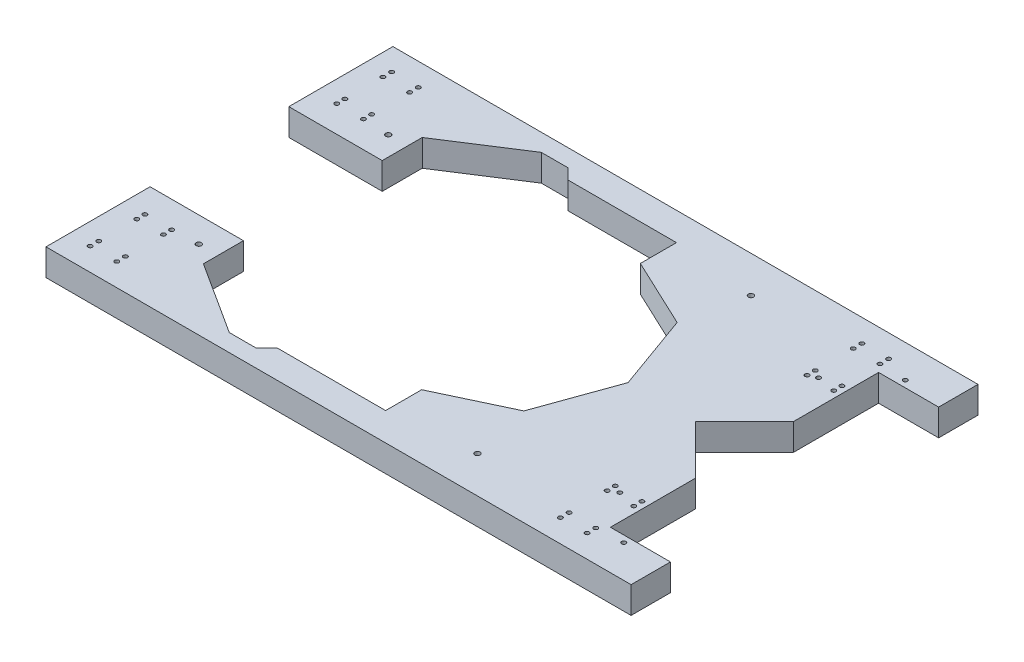
from build123d import *

# Parameters (mm, degrees)
SKETCH1_W                   = 600.075
SKETCH1_H                   = 330.2
BOSS_EXTRUDE1_DEPTH         = 25.4
CUT_EXTRUDE1_DEPTH          = 2.54
CUT_EXTRUDE2_DEPTH          = 2.54
CUT_EXTRUDE3_REACH          = 345.403
SKETCH4_W                   = 153.035
SKETCH4_H                   = 276.86
F_21_0_159_DIAMETER_HOLE1_D = 4.0386
MIRROR4_COPY_1_D            = 4.0386
F_5_0MM_DOWEL_HOLE2_D       = 5
CUT_EXTRUDE4_REACH          = 345.403
SKETCH18_W                  = 57.15
SKETCH18_H                  = 255.27
SKETCH19_R                  = 2.032
CUT_EXTRUDE5_DEPTH          = 12.7
CUT_EXTRUDE6_REACH          = 345.403
SKETCH20_R                  = 2.0193
CUT_EXTRUDE7_REACH          = 345.403
SKETCH21_R                  = 2.0193
LPATTERN1_COUNT             = 2
LPATTERN1_PITCH             = 447.675
MIRROR5_COPY_1_REACH        = 345.403
MIRROR5_COPY_1_SKETCH_R     = 2.0193
MIRROR5_COPY_2_REACH        = 345.403
MIRROR5_COPY_2_SKETCH_R     = 2.0193
CUT_EXTRUDE8_REACH          = 345.403
SKETCH22_R                  = 2.032
SKETCH23_R                  = 3.6068
SKETCH23_R_2                = 2.0193
SKETCH23_R_3                = 4.08813
SKETCH23_R_4                = 2.50063
SKETCH23_R_5                = 3.6195
SKETCH23_R_6                = 2.032
BOSS_EXTRUDE2_DEPTH         = 25.4
CUT_EXTRUDE9_START          = -25.4
CUT_EXTRUDE9_DEPTH          = 25.4
CUT_EXTRUDE10_REACH         = 345.403
SKETCH25_R                  = 2.032


with BuildPart() as part:
    # Sketch1 → Boss-Extrude1 (new body)
    with BuildSketch(Plane(origin=(0, 0, 0), x_dir=(1, 0, 0), z_dir=(0, 1, 0))):
        Rectangle(SKETCH1_W, SKETCH1_H)
    extrude(amount=BOSS_EXTRUDE1_DEPTH)

    # Sketch2 → Cut-Extrude1 (cut)
    # profile 1 of 4: a face of its own
    with BuildSketch(Plane.ZY.offset(300.0375)):
        with BuildLine():
            Line((-29.307692308, 31.75), (-25.590805288, 31.75))
            add(Edge.make_bspline(
                [(-25.590805288, 31.75), (-25.408858857, 31.749043416), (-25.056201391, 31.747189317), (-24.543378429, 31.718433989), (-24.06305276, 31.679225443), (-23.615085084, 31.617013082), (-23.199682404, 31.541946409), (-22.815592836, 31.45104081), (-22.464037755, 31.342038813), (-22.044324147, 31.168704053), (-21.56578455, 30.911130809), (-21.047633298, 30.530519618), (-20.604561653, 30.06497864), (-20.222547555, 29.53983733), (-19.918830032, 28.962155487), (-19.699105714, 28.345701902), (-19.559997849, 27.69842785), (-19.545691658, 27.254055696), (-19.538461538, 27.029477163)],
                knots=[0, 0, 0, 0, 1.001505555, 1.941167018, 2.826882275, 3.653841531, 4.429895133, 5.150066043, 5.825578002, 6.45369114, 7.647487171, 8.808567382, 9.977351308, 11.170798116, 12.373658725, 13.556498008, 14.765093433, 16, 16, 16, 16], degree=3))
            add(Edge.make_bspline(
                [(-19.538461538, 27.029477163), (-19.54441177, 26.819096825), (-19.556104537, 26.405679619), (-19.667915841, 25.801010253), (-19.842961765, 25.225421476), (-20.08628605, 24.681013921), (-20.402526915, 24.180088113), (-20.777312907, 23.718603136), (-21.229488074, 23.316098097), (-21.568269138, 23.091074585), (-21.740354567, 22.976772837)],
                knots=[0, 0, 0, 0, 1.044552857, 2.05264487, 3.044412934, 4.028983338, 5.005914585, 5.980388656, 6.974128949, 8, 8, 8, 8], degree=3))
            add(Edge.make_bspline(
                [(-21.740354567, 22.976772837), (-21.52394424, 22.893687628), (-21.109897675, 22.734725042), (-20.540106664, 22.453680588), (-20.049189008, 22.147998245), (-19.633370256, 21.814177746), (-19.277746735, 21.454356933), (-18.967215724, 21.063259811), (-18.702249959, 20.635784572), (-18.475212475, 20.176388187), (-18.298054246, 19.689761552), (-18.165379681, 19.180469185), (-18.08935685, 18.65033732), (-18.078538403, 18.289555469), (-18.073076923, 18.107421875)],
                knots=[0, 0, 0, 0, 1.27268992, 2.434971085, 3.483601985, 4.442670788, 5.356604649, 6.2567628, 7.179492994, 8.113709626, 9.066344395, 10.018646069, 10.999752585, 12, 12, 12, 12], degree=3))
            add(Edge.make_bspline(
                [(-18.073076923, 18.107421875), (-18.078393756, 17.921456471), (-18.088854775, 17.555564329), (-18.166034336, 17.018054239), (-18.296712475, 16.504384887), (-18.476714, 16.011233821), (-18.711640313, 15.539555089), (-18.997542519, 15.088814324), (-19.338437172, 14.663540324), (-19.719779359, 14.259007461), (-20.151191894, 13.895273362), (-20.616641931, 13.571337873), (-21.121991186, 13.304931449), (-21.658939897, 13.081142817), (-22.233511389, 12.910197923), (-22.84312558, 12.790604342), (-23.487256709, 12.710022641), (-23.929269783, 12.703397568), (-24.155949519, 12.7)],
                knots=[0, 0, 0, 0, 0.978564426, 1.925352924, 2.850884081, 3.763762016, 4.682927383, 5.618979971, 6.567305752, 7.547517671, 8.540179244, 9.531824382, 10.526200242, 11.540722885, 12.589160233, 13.674978461, 14.80764778, 16, 16, 16, 16], degree=3))
            Line((-24.155949519, 12.7), (-29.307692308, 12.7))
            Line((-29.307692308, 12.7), (-29.307692308, 31.75))
        make_face()
        with BuildLine():
            Line((-27.598076923, 29.796153846), (-27.598076923, 23.690384615))
            Line((-27.598076923, 23.690384615), (-26.449429087, 23.690384615))
            add(Edge.make_bspline(
                [(-26.449429087, 23.690384615), (-26.2815235, 23.692561339), (-25.957095691, 23.696767213), (-25.487268825, 23.70881507), (-25.051159798, 23.742550135), (-24.649521392, 23.776275504), (-24.28298609, 23.831110046), (-23.952365929, 23.896381458), (-23.652472137, 23.965412698), (-23.306635468, 24.082812334), (-22.914352706, 24.256317966), (-22.496161096, 24.525586103), (-22.127492054, 24.846302939), (-21.816175933, 25.216368031), (-21.561387786, 25.623853986), (-21.384420279, 26.062259149), (-21.264420061, 26.520657296), (-21.25358044, 26.835353787), (-21.248076923, 26.995132212)],
                knots=[0, 0, 0, 0, 1.156816544, 2.235205308, 3.236616184, 4.169592532, 5.011045266, 5.787822928, 6.49130361, 7.128639758, 8.301311294, 9.436451833, 10.541879658, 11.654887649, 12.756523258, 13.837046038, 14.901820046, 16, 16, 16, 16], degree=3))
            add(Edge.make_bspline(
                [(-21.248076923, 26.995132212), (-21.250940847, 27.100863911), (-21.256558745, 27.308268185), (-21.302568864, 27.610615384), (-21.380769519, 27.894970665), (-21.481213601, 28.165230894), (-21.621577749, 28.412945393), (-21.786841743, 28.646679073), (-21.986516714, 28.858472175), (-22.213795801, 29.056426159), (-22.475099877, 29.231928517), (-22.770273051, 29.385638957), (-23.103308837, 29.509413755), (-23.468594519, 29.617814528), (-23.871752866, 29.693950813), (-24.308131507, 29.757378537), (-24.781304763, 29.789669604), (-25.108665964, 29.793944222), (-25.277884615, 29.796153846)],
                knots=[0, 0, 0, 0, 0.91205012, 1.789085906, 2.630437955, 3.453916878, 4.269457761, 5.079663411, 5.91843418, 6.774407191, 7.675494373, 8.627863946, 9.638891023, 10.736472738, 11.911756761, 13.175263542, 14.539845004, 16, 16, 16, 16], degree=3))
            Line((-25.277884615, 29.796153846), (-27.598076923, 29.796153846))
        make_face(mode=Mode.SUBTRACT)
        with BuildLine():
            Line((-27.598076923, 21.736538462), (-27.598076923, 14.653846154))
            Line((-27.598076923, 14.653846154), (-25.163401442, 14.653846154))
            add(Edge.make_bspline(
                [(-25.163401442, 14.653846154), (-24.989127003, 14.655934836), (-24.653235995, 14.659960496), (-24.168270728, 14.673102571), (-23.718782692, 14.702996243), (-23.306822982, 14.750054368), (-22.927943233, 14.801099927), (-22.586688592, 14.869741327), (-22.280292782, 14.948384955), (-21.92501405, 15.069946664), (-21.524944954, 15.258794599), (-21.093811579, 15.54353346), (-20.710491735, 15.882750321), (-20.384980252, 16.275348582), (-20.118209558, 16.70223909), (-19.924142009, 17.154787352), (-19.804448918, 17.625515723), (-19.78995911, 17.946463115), (-19.782692308, 18.107421875)],
                knots=[0, 0, 0, 0, 1.160039823, 2.235823828, 3.228722157, 4.157150951, 4.99529583, 5.772374946, 6.472645482, 7.099169577, 8.269452708, 9.405989375, 10.527446681, 11.663510218, 12.788923519, 13.866172445, 14.929861265, 16, 16, 16, 16], degree=3))
            add(Edge.make_bspline(
                [(-19.782692308, 18.107421875), (-19.784195104, 18.208078486), (-19.787176457, 18.407768106), (-19.832137804, 18.701224208), (-19.897527581, 18.985482176), (-19.982062957, 19.261313877), (-20.105177485, 19.523732397), (-20.248904537, 19.777927757), (-20.417423023, 20.024235981), (-20.680009126, 20.335634103), (-21.061945213, 20.694410988), (-21.604634948, 21.045679393), (-22.22170417, 21.328968171), (-22.669256667, 21.449252464), (-22.900450721, 21.511388221)],
                knots=[0, 0, 0, 0, 0.723448775, 1.435228256, 2.130040452, 2.821711965, 3.505591119, 4.210454504, 4.921174351, 5.648778258, 7.137944449, 8.670945889, 10.280296675, 12, 12, 12, 12], degree=3))
            add(Edge.make_bspline(
                [(-22.900450721, 21.511388221), (-22.993137657, 21.53019375), (-23.194102053, 21.570968014), (-23.521803312, 21.614008514), (-23.895922827, 21.652353768), (-24.317324487, 21.680717355), (-24.786541451, 21.710035542), (-25.304575823, 21.721437354), (-25.869312064, 21.73504047), (-26.261156262, 21.736026358), (-26.46469351, 21.736538462)],
                knots=[0, 0, 0, 0, 0.634451884, 1.375622551, 2.216452059, 3.157844607, 4.20941857, 5.370758133, 6.634282058, 8, 8, 8, 8], degree=3))
            Line((-26.46469351, 21.736538462), (-27.598076923, 21.736538462))
        make_face(mode=Mode.SUBTRACT)
    # profile 2 of 4: a face of its own
    with BuildSketch(Plane.ZY.offset(300.0375)):
        with BuildLine():
            Line((-0.488461538, 26.621153846), (-0.488461538, 12.7))
            Line((-0.488461538, 12.7), (-2.198076923, 12.7))
            Line((-2.198076923, 12.7), (-2.198076923, 15.10796274))
            add(Edge.make_bspline(
                [(-2.198076923, 15.10796274), (-2.390856341, 14.89003295), (-2.767067798, 14.464740225), (-3.395397312, 13.909121543), (-4.061429823, 13.449862393), (-4.761932728, 13.078932138), (-5.496273452, 12.800301088), (-6.262824156, 12.602256422), (-7.061897529, 12.474927119), (-7.607556774, 12.462212486), (-7.884074519, 12.455769231)],
                knots=[0, 0, 0, 0, 1.074387032, 2.096679803, 3.090159297, 4.057316773, 5.018401886, 5.985159533, 6.978961417, 8, 8, 8, 8], degree=3))
            add(Edge.make_bspline(
                [(-7.884074519, 12.455769231), (-8.129917239, 12.4624442), (-8.614729969, 12.475607534), (-9.327902517, 12.577728073), (-10.014204618, 12.741724742), (-10.674284792, 12.969785298), (-11.303871755, 13.27230377), (-11.908355995, 13.634478277), (-12.484605933, 14.065774795), (-13.023838167, 14.558832492), (-13.520400912, 15.094382351), (-13.956162981, 15.66558597), (-14.319490459, 16.269973367), (-14.623311184, 16.89989239), (-14.857334144, 17.560192167), (-15.020476354, 18.248589324), (-15.122477928, 18.964269921), (-15.135635821, 19.451620754), (-15.142307692, 19.698737981)],
                knots=[0, 0, 0, 0, 1.033919861, 2.038935746, 3.024066025, 3.998881131, 4.97069526, 5.957263378, 6.95902576, 7.993208707, 9.027059324, 10.027763471, 11.009749337, 11.988697705, 12.965288445, 13.950418724, 14.960734635, 16, 16, 16, 16], degree=3))
            add(Edge.make_bspline(
                [(-15.142307692, 19.698737981), (-15.135487948, 19.940747567), (-15.122005682, 20.419187465), (-15.021567442, 21.122832949), (-14.852670095, 21.800568054), (-14.615645381, 22.450210845), (-14.311705598, 23.072547404), (-13.941982724, 23.668017883), (-13.50645006, 24.238262746), (-13.004333387, 24.769873281), (-12.46040271, 25.260931195), (-11.87851376, 25.687700429), (-11.273141329, 26.056273563), (-10.634895514, 26.34830177), (-9.97322313, 26.584571324), (-9.282233661, 26.748036479), (-8.564802068, 26.844360471), (-8.077718104, 26.85830923), (-7.830649038, 26.865384615)],
                knots=[0, 0, 0, 0, 1.020392517, 2.01726096, 2.990465484, 3.961182959, 4.928053699, 5.906110375, 6.912531644, 7.948652711, 8.985773172, 9.998621852, 10.987621588, 11.969261332, 12.953316658, 13.946091881, 14.958173133, 16, 16, 16, 16], degree=3))
            add(Edge.make_bspline(
                [(-7.830649038, 26.865384615), (-7.546532663, 26.857559139), (-6.989393859, 26.84221375), (-6.174445694, 26.714509477), (-5.403495036, 26.498762962), (-4.670590634, 26.205297723), (-3.978364329, 25.815323926), (-3.333369514, 25.32339871), (-2.728855955, 24.732624535), (-2.378443224, 24.278851116), (-2.198076923, 24.045282452)],
                knots=[0, 0, 0, 0, 1.038897134, 2.037228247, 3.008116434, 3.962042015, 4.918381754, 5.904844433, 6.921570401, 8, 8, 8, 8], degree=3))
            Line((-2.198076923, 24.045282452), (-2.198076923, 26.621153846))
            Line((-2.198076923, 26.621153846), (-0.488461538, 26.621153846))
        make_face()
        with BuildLine():
            add(Edge.make_bspline(
                [(-7.807752404, 25.155769231), (-8.057657586, 25.146877574), (-8.550930666, 25.129326858), (-9.275070162, 24.99231112), (-9.968018888, 24.764339256), (-10.626311092, 24.452562051), (-11.2395481, 24.060519928), (-11.787609365, 23.586330684), (-12.274977497, 23.042932079), (-12.684869621, 22.432776306), (-13.019009325, 21.778664125), (-13.253961313, 21.094908255), (-13.40891536, 20.393841163), (-13.424746022, 19.918338544), (-13.432692308, 19.679657452)],
                knots=[0, 0, 0, 0, 1.031046209, 2.035121221, 3.029706178, 4.034933723, 5.034054252, 6.02443088, 7.017295772, 8.038157696, 9.050218397, 10.03989886, 11.016116709, 12, 12, 12, 12], degree=3))
            add(Edge.make_bspline(
                [(-13.432692308, 19.679657452), (-13.42254196, 19.442402726), (-13.40228105, 18.968823232), (-13.256680842, 18.266800378), (-13.012406102, 17.582883378), (-12.679074304, 16.922877113), (-12.261679961, 16.310097938), (-11.777871723, 15.756340985), (-11.222970906, 15.280147655), (-10.608322618, 14.881526004), (-9.951870665, 14.559512855), (-9.261531695, 14.33545416), (-8.550282864, 14.190795097), (-8.066672304, 14.173897873), (-7.823016827, 14.165384615)],
                knots=[0, 0, 0, 0, 0.979072187, 1.954306742, 2.945804271, 3.96968567, 4.997920485, 5.998718438, 6.996577872, 8.005894225, 9.015743152, 10.005417472, 10.995077863, 12, 12, 12, 12], degree=3))
            add(Edge.make_bspline(
                [(-7.823016827, 14.165384615), (-7.575658005, 14.174419562), (-7.083685841, 14.192389174), (-6.357398017, 14.32999149), (-5.652575433, 14.557333092), (-4.978819233, 14.872469768), (-4.351170005, 15.263034805), (-3.787845843, 15.7202734), (-3.311508929, 16.252057874), (-2.907689154, 16.836492568), (-2.591048672, 17.477182149), (-2.360401835, 18.159358244), (-2.224037005, 18.883044602), (-2.206849934, 19.377603976), (-2.198076923, 19.630048077)],
                knots=[0, 0, 0, 0, 1.01762866, 2.023962475, 3.030623092, 4.058876274, 5.077231937, 6.066672613, 7.034107872, 8.005628644, 8.981990164, 9.965428785, 10.961468474, 12, 12, 12, 12], degree=3))
            add(Edge.make_bspline(
                [(-2.198076923, 19.630048077), (-2.203300196, 19.82238684), (-2.213581249, 20.200970393), (-2.292124777, 20.756835882), (-2.417065163, 21.28878659), (-2.593120745, 21.797381798), (-2.824394736, 22.279809525), (-3.103329005, 22.739533705), (-3.434828667, 23.174163327), (-3.813557341, 23.577713471), (-4.228113658, 23.945794644), (-4.666778229, 24.274348583), (-5.134748266, 24.544253188), (-5.624153853, 24.767634966), (-6.135844116, 24.945394053), (-6.673982775, 25.063981358), (-7.232849833, 25.145408248), (-7.614100506, 25.152279207), (-7.807752404, 25.155769231)],
                knots=[0, 0, 0, 0, 1.050140795, 2.067009409, 3.05949893, 4.030605086, 5.00011959, 5.97591094, 6.962425594, 7.979863591, 8.993523472, 9.986985069, 10.967611495, 11.937549037, 12.921786183, 13.919465291, 14.943216303, 16, 16, 16, 16], degree=3))
        make_face(mode=Mode.SUBTRACT)
    # profile 3 of 4: a face of its own
    with BuildSketch(Plane.ZY.offset(300.0375)):
        with BuildLine():
            Line((17.096153846, 23.602614183), (15.665114183, 22.713461538))
            add(Edge.make_bspline(
                [(15.665114183, 22.713461538), (15.508197344, 22.908470368), (15.199333188, 23.29231214), (14.662998202, 23.787666205), (14.091436076, 24.213118247), (13.474879845, 24.559848662), (12.814194276, 24.827753985), (12.111984871, 25.017329818), (11.368351766, 25.135462911), (10.858545469, 25.148889552), (10.597325721, 25.155769231)],
                knots=[0, 0, 0, 0, 1.026593902, 2.0206758, 2.988051866, 3.946915611, 4.916868779, 5.907761954, 6.927957743, 8, 8, 8, 8], degree=3))
            add(Edge.make_bspline(
                [(10.597325721, 25.155769231), (10.388543399, 25.15001699), (9.977352291, 25.138688107), (9.373705942, 25.06787385), (8.798709705, 24.939193777), (8.248759561, 24.769643569), (7.727766997, 24.542402706), (7.234366998, 24.265852462), (6.764183117, 23.944451528), (6.330840568, 23.572102702), (5.934442686, 23.167161383), (5.591004311, 22.733073412), (5.291990432, 22.282840861), (5.05737087, 21.805220664), (4.865373156, 21.311139575), (4.739062293, 20.791271303), (4.654890166, 20.252276005), (4.645259963, 19.884783327), (4.640384615, 19.698737981)],
                knots=[0, 0, 0, 0, 1.112346261, 2.190735716, 3.231507886, 4.247384806, 5.251966152, 6.253067467, 7.256802811, 8.280671706, 9.291813951, 10.270744147, 11.225547591, 12.165006084, 13.100104208, 14.043489273, 15.009504848, 16, 16, 16, 16], degree=3))
            add(Edge.make_bspline(
                [(4.640384615, 19.698737981), (4.650068831, 19.455065561), (4.669306776, 18.971003995), (4.820081864, 18.256476041), (5.066884995, 17.565648526), (5.404657011, 16.903426237), (5.831796842, 16.290592335), (6.333478937, 15.740953819), (6.909981376, 15.265160865), (7.55622449, 14.870703265), (8.257034494, 14.553594964), (9.004829207, 14.32767648), (9.793498012, 14.191319996), (10.333466164, 14.174142648), (10.608774038, 14.165384615)],
                knots=[0, 0, 0, 0, 0.966302908, 1.919585723, 2.883856336, 3.870342332, 4.860282998, 5.839159637, 6.814385684, 7.815993281, 8.834850808, 9.858348828, 10.908058873, 12, 12, 12, 12], degree=3))
            add(Edge.make_bspline(
                [(10.608774038, 14.165384615), (10.861078685, 14.172457593), (11.356924268, 14.186357871), (12.081734777, 14.303536943), (12.77177972, 14.495363006), (13.427034572, 14.762866644), (14.046301991, 15.108637837), (14.625580785, 15.53513561), (15.176397592, 16.030090535), (15.500231136, 16.412821207), (15.665114183, 16.607692308)],
                knots=[0, 0, 0, 0, 1.039848629, 2.043578496, 3.018386758, 3.987534228, 4.954977003, 5.934852016, 6.948509513, 8, 8, 8, 8], degree=3))
            Line((15.665114183, 16.607692308), (17.096153846, 15.668930288))
            add(Edge.make_bspline(
                [(17.096153846, 15.668930288), (17.01131221, 15.544339332), (16.841910537, 15.295570952), (16.558731604, 14.944810831), (16.253279378, 14.616488532), (15.926745522, 14.311044151), (15.583393711, 14.021168361), (15.21149466, 13.760719077), (14.823040061, 13.515056685), (14.413469645, 13.294006623), (13.987017989, 13.09530793), (13.544285159, 12.924450272), (13.087195036, 12.777655839), (12.615210189, 12.660975423), (12.127400113, 12.567843573), (11.625026389, 12.506046998), (11.108262038, 12.459917253), (10.758982186, 12.457163892), (10.582061298, 12.455769231)],
                knots=[0, 0, 0, 0, 0.954134338, 1.905101784, 2.851144739, 3.791306361, 4.734911809, 5.6936923, 6.663572882, 7.643865596, 8.638447847, 9.640600242, 10.646758161, 11.676244097, 12.717260333, 13.78922464, 14.880174919, 16, 16, 16, 16], degree=3))
            add(Edge.make_bspline(
                [(10.582061298, 12.455769231), (10.312036345, 12.460620339), (9.782785478, 12.470128548), (9.008144401, 12.574677535), (8.267841441, 12.732289704), (7.562129521, 12.95851517), (6.890898775, 13.249734018), (6.254775089, 13.605462367), (5.655864761, 14.028654252), (5.100090358, 14.511777326), (4.589651344, 15.035601386), (4.151358793, 15.600841653), (3.771200963, 16.186716499), (3.465924479, 16.806165491), (3.222917636, 17.45095559), (3.05688419, 18.126252182), (2.949498047, 18.826488022), (2.937069938, 19.304005566), (2.930769231, 19.54609375)],
                knots=[0, 0, 0, 0, 1.1129367, 2.181364009, 3.217532258, 4.231199276, 5.232079859, 6.230262199, 7.231623845, 8.250719726, 9.263571943, 10.242672461, 11.195837495, 12.138959767, 13.085126421, 14.0317438, 15.002148558, 16, 16, 16, 16], degree=3))
            add(Edge.make_bspline(
                [(2.930769231, 19.54609375), (2.933169619, 19.710350658), (2.937944386, 20.037084759), (2.992710021, 20.522016479), (3.063458853, 21.000490133), (3.183341793, 21.46644072), (3.321811517, 21.926935227), (3.498571197, 22.37642325), (3.705918989, 22.816993541), (3.94133316, 23.247511183), (4.206339044, 23.660893677), (4.499606899, 24.051438623), (4.810091072, 24.423837632), (5.152316767, 24.765234101), (5.511761169, 25.089281085), (5.898593602, 25.387321733), (6.310595309, 25.660231984), (6.741578822, 25.913058225), (7.191293322, 26.138171722), (7.657020485, 26.332118345), (8.135953973, 26.497867365), (8.628859901, 26.629088769), (9.132466643, 26.739129316), (9.650742783, 26.808350736), (10.181705592, 26.857261736), (10.541239087, 26.862654476), (10.723257212, 26.865384615)],
                knots=[0, 0, 0, 0, 0.990994727, 1.971252077, 2.943264845, 3.907940874, 4.872158414, 5.844625996, 6.82015047, 7.809835459, 8.804511986, 9.781214284, 10.756496977, 11.728388426, 12.696359165, 13.676225489, 14.672885716, 15.677705647, 16.690706858, 17.706033469, 18.721040654, 19.747369689, 20.783475414, 21.830280724, 22.901553713, 24, 24, 24, 24], degree=3))
            add(Edge.make_bspline(
                [(10.723257212, 26.865384615), (10.951204657, 26.860366894), (11.405960159, 26.850356532), (12.080551719, 26.766108439), (12.745207275, 26.639091659), (13.388265081, 26.450916685), (14.001928252, 26.223058788), (14.576342631, 25.967175299), (15.097986625, 25.670024672), (15.576563932, 25.344976621), (16.01296959, 24.978340834), (16.411683328, 24.565734395), (16.780881305, 24.109304673), (16.990195691, 23.772904907), (17.096153846, 23.602614183)],
                knots=[0, 0, 0, 0, 1.095225653, 2.184976855, 3.262915854, 4.344593502, 5.400796181, 6.407717688, 7.363229445, 8.282371371, 9.184954523, 10.097238608, 11.036792983, 12, 12, 12, 12], degree=3))
        make_face()
    # profile 4 of 4: a face of its own
    with BuildSketch(Plane.ZY.offset(300.0375)):
        Polygon((20.515384615, 32.238461538), (22.225, 32.238461538), (22.225, 20.942788462), (28.559735577, 26.621153846), (31.017307692, 26.621153846), (23.667487981, 20.026923077), (31.75, 12.7), (29.29624399, 12.7), (22.225, 19.114873798), (22.225, 12.7), (20.515384615, 12.7), align=None)
    extrude(amount=-CUT_EXTRUDE1_DEPTH, mode=Mode.SUBTRACT)

    # Sketch3 → Cut-Extrude2 (cut)
    # profile 1 of 5: a face of its own
    with BuildSketch(Plane(origin=(300.0375, 0, 0), x_dir=(0, 0, -1), z_dir=(1, 0, 0))):
        Polygon((-28.941346154, 31.75), (-19.660576923, 31.75), (-19.660576923, 29.796153846), (-27.231730769, 29.796153846), (-27.231730769, 23.934615385), (-19.660576923, 23.934615385), (-19.660576923, 21.980769231), (-27.231730769, 21.980769231), (-27.231730769, 12.7), (-28.941346154, 12.7), align=None)
    # profile 2 of 5: a face of its own
    with BuildSketch(Plane(origin=(300.0375, 0, 0), x_dir=(0, 0, -1), z_dir=(1, 0, 0))):
        with BuildLine():
            Line((-17.218269231, 26.621153846), (-15.508653846, 26.621153846))
            Line((-15.508653846, 26.621153846), (-15.508653846, 24.571905048))
            add(Edge.make_bspline(
                [(-15.508653846, 24.571905048), (-15.382440745, 24.762708914), (-15.14105917, 25.127619824), (-14.739850226, 25.610234162), (-14.32889638, 26.009821773), (-13.906230289, 26.328248068), (-13.468743773, 26.566716615), (-13.026038365, 26.74139442), (-12.571149022, 26.844685236), (-12.265467691, 26.858475579), (-12.112319712, 26.865384615)],
                knots=[0, 0, 0, 0, 1.2804753, 2.448899062, 3.506932113, 4.484331642, 5.4025378, 6.288909075, 7.142734305, 8, 8, 8, 8], degree=3))
            add(Edge.make_bspline(
                [(-12.112319712, 26.865384615), (-11.993522135, 26.858904749), (-11.749088399, 26.845572003), (-11.379068875, 26.751895944), (-10.997832372, 26.602336992), (-10.752128807, 26.461692352), (-10.624038462, 26.388371394)],
                knots=[0, 0, 0, 0, 0.901110191, 1.854092781, 2.881294221, 4, 4, 4, 4], degree=3))
            Line((-10.624038462, 26.388371394), (-11.562800481, 24.907722356))
            add(Edge.make_bspline(
                [(-11.562800481, 24.907722356), (-11.645036724, 24.944408661), (-11.801136858, 25.014046292), (-12.029489568, 25.09646209), (-12.240026558, 25.144990147), (-12.374157926, 25.152341909), (-12.436688702, 25.155769231)],
                knots=[0, 0, 0, 0, 1.180555205, 2.24091978, 3.179933427, 4, 4, 4, 4], degree=3))
            add(Edge.make_bspline(
                [(-12.436688702, 25.155769231), (-12.573879909, 25.146625027), (-12.853710203, 25.127973503), (-13.264561549, 24.981349421), (-13.663235625, 24.744447757), (-13.979855673, 24.481714991), (-14.225014221, 24.228361979), (-14.399948877, 24.007118531), (-14.560419257, 23.75904055), (-14.713745742, 23.488368986), (-14.853443715, 23.190482252), (-14.983825557, 22.868356476), (-15.101711654, 22.521618561), (-15.168932269, 22.280050844), (-15.203365385, 22.156310096)],
                knots=[0, 0, 0, 0, 1.125678352, 2.296057538, 3.5422874, 4.923748041, 5.663163013, 6.437101912, 7.23742474, 8.08941207, 8.991984279, 9.93940061, 10.944477711, 12, 12, 12, 12], degree=3))
            add(Edge.make_bspline(
                [(-15.203365385, 22.156310096), (-15.229123126, 22.045944337), (-15.286174565, 21.801492567), (-15.341645649, 21.391381311), (-15.396452597, 20.906838254), (-15.435078477, 20.346514656), (-15.470881821, 19.711809783), (-15.491075268, 19.001756707), (-15.507965219, 18.21562661), (-15.50841734, 17.66603763), (-15.508653846, 17.378545673)],
                knots=[0, 0, 0, 0, 0.566838948, 1.255505196, 2.06880316, 3.007127437, 4.065329342, 5.249902469, 6.561414163, 8, 8, 8, 8], degree=3))
            Line((-15.508653846, 17.378545673), (-15.508653846, 12.7))
            Line((-15.508653846, 12.7), (-17.218269231, 12.7))
            Line((-17.218269231, 12.7), (-17.218269231, 26.621153846))
        make_face()
    # profile 3 of 5: a face of its own
    with BuildSketch(Plane(origin=(300.0375, 0, 0), x_dir=(0, 0, -1), z_dir=(1, 0, 0))):
        with BuildLine():
            add(Edge.make_bspline(
                [(-2.190444712, 26.865384615), (-1.929235069, 26.859822608), (-1.417066797, 26.848916871), (-0.666998161, 26.732358272), (0.048983221, 26.554119046), (0.733619496, 26.307712401), (1.378142475, 25.977429213), (1.991940247, 25.583315785), (2.573329967, 25.116413383), (2.921798169, 24.755235897), (3.098677885, 24.571905048)],
                knots=[0, 0, 0, 0, 1.054011418, 2.066658804, 3.057071809, 4.030435133, 4.997543892, 5.974964718, 6.972108034, 8, 8, 8, 8], degree=3))
            add(Edge.make_bspline(
                [(3.098677885, 24.571905048), (3.250979663, 24.396568925), (3.552635761, 24.049289917), (3.939436316, 23.486195795), (4.272656522, 22.903047533), (4.53969921, 22.29210137), (4.750256268, 21.658690659), (4.899748129, 21.000638284), (4.988667732, 20.319397509), (5.000658166, 19.856733762), (5.006730769, 19.622415865)],
                knots=[0, 0, 0, 0, 1.025258237, 2.030674902, 3.01204498, 3.988269485, 4.97094183, 5.956517959, 6.965070386, 8, 8, 8, 8], degree=3))
            add(Edge.make_bspline(
                [(5.006730769, 19.622415865), (5.00138949, 19.386739837), (4.990834874, 18.921033014), (4.890993191, 18.235127609), (4.735702566, 17.570038646), (4.513460704, 16.928550613), (4.228482995, 16.308702652), (3.88073511, 15.713202105), (3.467776737, 15.140874065), (2.999669269, 14.596578346), (2.482315486, 14.094930805), (1.921069021, 13.65771551), (1.326959209, 13.283129784), (0.6920861, 12.981397293), (0.022247351, 12.743491639), (-0.684001834, 12.576395835), (-1.425564288, 12.475367242), (-1.931898165, 12.462393793), (-2.190444712, 12.455769231)],
                knots=[0, 0, 0, 0, 0.998656419, 1.973391657, 2.932242238, 3.890759089, 4.846373663, 5.82037756, 6.809684879, 7.83454468, 8.860553229, 9.859544525, 10.845671541, 11.83227036, 12.833544569, 13.85385346, 14.904124723, 16, 16, 16, 16], degree=3))
            add(Edge.make_bspline(
                [(-2.190444712, 12.455769231), (-2.450257971, 12.462416027), (-2.959115364, 12.475434114), (-3.703295352, 12.576003324), (-4.410810277, 12.74341463), (-5.081525935, 12.982179126), (-5.719128602, 13.283139428), (-6.316680821, 13.656583053), (-6.878383219, 14.095060469), (-7.395846448, 14.596543212), (-7.863924571, 15.140883117), (-8.276890517, 15.713199756), (-8.624636435, 16.308703264), (-8.909614659, 16.928550449), (-9.131856383, 17.570038689), (-9.287147045, 18.235127597), (-9.386988718, 18.921033017), (-9.397543336, 19.386739838), (-9.402884615, 19.622415865)],
                knots=[0, 0, 0, 0, 1.099876186, 2.154163076, 3.173186993, 4.173200201, 5.163417411, 6.152872554, 7.150605724, 8.17532212, 9.198891216, 10.186952605, 11.159729845, 12.11414092, 13.071450619, 14.029093627, 15.002601286, 16, 16, 16, 16], degree=3))
            add(Edge.make_bspline(
                [(-9.402884615, 19.622415865), (-9.396770598, 19.855460208), (-9.384665893, 20.316847955), (-9.295835694, 20.9968081), (-9.146926979, 21.653746746), (-8.936117521, 22.284712551), (-8.666613411, 22.892981424), (-8.338075544, 23.477570576), (-7.947329387, 24.038118461), (-7.64687305, 24.38494864), (-7.494831731, 24.560456731)],
                knots=[0, 0, 0, 0, 1.031353054, 2.041901799, 3.029428768, 4.008703097, 4.981709435, 5.96992636, 6.972712378, 8, 8, 8, 8], degree=3))
            add(Edge.make_bspline(
                [(-7.494831731, 24.560456731), (-7.318218685, 24.745377472), (-6.970878055, 25.109056647), (-6.386594265, 25.574597956), (-5.774306468, 25.976912587), (-5.122660798, 26.300633131), (-4.438586957, 26.555568492), (-3.718936509, 26.732817938), (-2.966322632, 26.848496913), (-2.451648122, 26.859699281), (-2.190444712, 26.865384615)],
                knots=[0, 0, 0, 0, 1.027980169, 2.021703884, 2.998553061, 3.971491411, 4.943284454, 5.930300938, 6.949603206, 8, 8, 8, 8], degree=3))
        make_face()
        with BuildLine():
            add(Edge.make_bspline(
                [(-2.198076923, 25.155769231), (-2.382794493, 25.150519096), (-2.747461179, 25.140154358), (-3.28423349, 25.061320534), (-3.800979185, 24.936420547), (-4.298678637, 24.758961327), (-4.775653475, 24.529823034), (-5.232360366, 24.248381817), (-5.670142646, 23.918365296), (-6.080436448, 23.540289898), (-6.45698589, 23.127291371), (-6.786158877, 22.687245303), (-7.066058384, 22.227289333), (-7.299231249, 21.746945155), (-7.472897516, 21.241345016), (-7.599024967, 20.716214723), (-7.677784418, 20.170484385), (-7.688051708, 19.7994937), (-7.693269231, 19.610967548)],
                knots=[0, 0, 0, 0, 1.021534396, 2.016698045, 2.994645724, 3.958388632, 4.93408049, 5.916473867, 6.921342795, 7.962252576, 8.998418191, 10.008913653, 10.997312074, 11.973003931, 12.956656626, 13.948281152, 14.957379055, 16, 16, 16, 16], degree=3))
            add(Edge.make_bspline(
                [(-7.693269231, 19.610967548), (-7.684523519, 19.367388657), (-7.667164917, 18.883930107), (-7.52600313, 18.171943854), (-7.289857807, 17.488419773), (-6.970975613, 16.837364872), (-6.571436052, 16.234991473), (-6.100699303, 15.69793668), (-5.563817505, 15.234282477), (-4.967190554, 14.849576732), (-4.32300491, 14.543907205), (-3.641252648, 14.327287066), (-2.930194013, 14.18647114), (-2.444251748, 14.172474972), (-2.198076923, 14.165384615)],
                knots=[0, 0, 0, 0, 1.016792936, 2.018143844, 3.017858371, 4.030088057, 5.03801393, 6.028138512, 7.003788237, 7.991172063, 8.984598303, 9.972568034, 10.972917682, 12, 12, 12, 12], degree=3))
            add(Edge.make_bspline(
                [(-2.198076923, 14.165384615), (-1.951916258, 14.172516284), (-1.466001943, 14.186593999), (-0.75593128, 14.32657786), (-0.076042376, 14.544856357), (0.567474176, 14.849232956), (1.163829546, 15.235743385), (1.704572621, 15.695318523), (2.171290061, 16.236413914), (2.570434397, 16.838162749), (2.89453881, 17.487410437), (3.129578809, 18.172070008), (3.271079955, 18.883897979), (3.288392751, 19.367377893), (3.297115385, 19.610967548)],
                knots=[0, 0, 0, 0, 1.02726834, 2.027799167, 3.010890988, 4.004497153, 4.992059811, 5.971914811, 6.958719428, 7.966827853, 8.981595046, 9.981490638, 10.983022906, 12, 12, 12, 12], degree=3))
            add(Edge.make_bspline(
                [(3.297115385, 19.610967548), (3.291899658, 19.799494826), (3.281635904, 20.170487729), (3.20285074, 20.716201941), (3.076818446, 21.241391917), (2.902801501, 21.746772106), (2.670641797, 22.228533022), (2.38534468, 22.685894822), (2.057515813, 23.128815737), (1.676422626, 23.538954839), (1.266557098, 23.918512681), (0.82859739, 24.248509786), (0.372567721, 24.528586128), (-0.103021421, 24.760921237), (-0.600784682, 24.934806047), (-1.116806343, 25.062041712), (-1.651288437, 25.139821211), (-2.014648372, 25.150419224), (-2.198076923, 25.155769231)],
                knots=[0, 0, 0, 0, 1.042956736, 2.052379634, 3.044323526, 4.02829302, 5.004299113, 5.996692471, 7.007513377, 8.048758398, 9.090003419, 10.095195979, 11.07790575, 12.047570684, 13.018257071, 13.989683339, 14.985167495, 16, 16, 16, 16], degree=3))
        make_face(mode=Mode.SUBTRACT)
    # profile 4 of 5: a face of its own
    with BuildSketch(Plane(origin=(300.0375, 0, 0), x_dir=(0, 0, -1), z_dir=(1, 0, 0))):
        with BuildLine():
            Line((8.425961538, 26.621153846), (10.135576923, 26.621153846))
            Line((10.135576923, 26.621153846), (10.135576923, 24.11015625))
            add(Edge.make_bspline(
                [(10.135576923, 24.11015625), (10.31811748, 24.337900213), (10.672343799, 24.779845318), (11.262264242, 25.36071016), (11.885710328, 25.839383456), (12.53886409, 26.220948392), (13.222612188, 26.508585029), (13.932786771, 26.716316739), (14.673639671, 26.840875592), (15.177454678, 26.857150988), (15.432331731, 26.865384615)],
                knots=[0, 0, 0, 0, 1.12780773, 2.188550248, 3.19190651, 4.159438251, 5.104880172, 6.052711206, 7.014878035, 8, 8, 8, 8], degree=3))
            add(Edge.make_bspline(
                [(15.432331731, 26.865384615), (15.689945611, 26.855885766), (16.194158114, 26.837294226), (16.928280134, 26.690246236), (17.613935319, 26.439084205), (18.248678902, 26.095029936), (18.820871306, 25.66718613), (19.323382283, 25.168741347), (19.739016529, 24.595412094), (20.017676462, 24.063518915), (20.201240345, 23.591684192), (20.316804925, 23.187569738), (20.414944981, 22.737346658), (20.500026352, 22.242375466), (20.557596061, 21.699188173), (20.603001962, 21.110011449), (20.635543141, 20.475036139), (20.636834225, 20.035870353), (20.6375, 19.809405048)],
                knots=[0, 0, 0, 0, 1.235846778, 2.418850247, 3.575807741, 4.728682307, 5.871620074, 6.994088408, 8.11269785, 9.256955736, 9.865816715, 10.540099792, 11.271859618, 12.076849838, 12.949306005, 13.892391288, 14.913166135, 16, 16, 16, 16], degree=3))
            Line((20.6375, 19.809405048), (20.6375, 12.7))
            Line((20.6375, 12.7), (18.927884615, 12.7))
            Line((18.927884615, 12.7), (18.927884615, 19.2484375))
            add(Edge.make_bspline(
                [(18.927884615, 19.2484375), (18.926833012, 19.437971093), (18.924821473, 19.8005166), (18.918477025, 20.319596569), (18.903183649, 20.79033066), (18.881693545, 21.211593474), (18.850239108, 21.582980499), (18.817458786, 21.905248134), (18.777372269, 22.177987215), (18.741651271, 22.342171449), (18.72563101, 22.415805288)],
                knots=[0, 0, 0, 0, 1.430800155, 2.736877192, 3.918605307, 4.986035426, 5.920637409, 6.731861385, 7.431261377, 8, 8, 8, 8], degree=3))
            add(Edge.make_bspline(
                [(18.72563101, 22.415805288), (18.66779776, 22.631947595), (18.556486646, 23.047954662), (18.281437395, 23.612239353), (17.934105926, 24.09228949), (17.51011906, 24.485137074), (17.013572234, 24.790866914), (16.445843357, 25.002996582), (15.812411041, 25.135673133), (15.36688933, 25.148883666), (15.134675481, 25.155769231)],
                knots=[0, 0, 0, 0, 1.084156227, 2.086665306, 3.027808233, 3.945421172, 4.874247719, 5.839848303, 6.874090471, 8, 8, 8, 8], degree=3))
            add(Edge.make_bspline(
                [(15.134675481, 25.155769231), (14.997147089, 25.153178405), (14.724981954, 25.148051229), (14.32139425, 25.096609164), (13.92992125, 25.012470998), (13.546634112, 24.898885986), (13.179198835, 24.742881349), (12.815810336, 24.565828634), (12.470152091, 24.345130509), (12.134853601, 24.099164412), (11.822908176, 23.826590441), (11.532649649, 23.538965322), (11.273906996, 23.23266525), (11.039490349, 22.912625535), (10.837134372, 22.574450817), (10.66049685, 22.221403663), (10.510623997, 21.853019396), (10.436151057, 21.597340849), (10.398888221, 21.469411058)],
                knots=[0, 0, 0, 0, 1.023777757, 2.026029729, 3.023749952, 4.003683103, 4.997618607, 5.993177895, 7.010360494, 8.046726602, 9.087585522, 10.09234134, 11.086953743, 12.070360549, 13.043493632, 14.017870808, 15.008233677, 16, 16, 16, 16], degree=3))
            add(Edge.make_bspline(
                [(10.398888221, 21.469411058), (10.377445277, 21.375493452), (10.330765109, 21.171039739), (10.280346944, 20.835517971), (10.234585712, 20.447387964), (10.196284552, 20.007102638), (10.172850785, 19.513120489), (10.147299854, 18.967551144), (10.137997679, 18.368219157), (10.136406437, 17.950960515), (10.135576923, 17.73344351)],
                knots=[0, 0, 0, 0, 0.615963638, 1.340920617, 2.168419149, 3.115676021, 4.16674242, 5.331190069, 6.6087489, 8, 8, 8, 8], degree=3))
            Line((10.135576923, 17.73344351), (10.135576923, 12.7))
            Line((10.135576923, 12.7), (8.425961538, 12.7))
            Line((8.425961538, 12.7), (8.425961538, 26.621153846))
        make_face()
    # profile 5 of 5: a face of its own
    with BuildSketch(Plane(origin=(300.0375, 0, 0), x_dir=(0, 0, -1), z_dir=(1, 0, 0))):
        Polygon((26.254807692, 32.238461538), (27.964423077, 32.238461538), (27.964423077, 26.621153846), (30.406730769, 26.621153846), (30.406730769, 24.911538462), (27.964423077, 24.911538462), (27.964423077, 12.7), (26.254807692, 12.7), (26.254807692, 24.911538462), (23.8125, 24.911538462), (23.8125, 26.621153846), (26.254807692, 26.621153846), align=None)
    extrude(amount=-CUT_EXTRUDE2_DEPTH, mode=Mode.SUBTRACT)

    # Sketch4 → Cut-Extrude3 (cut, up to next)
    with BuildSketch(Plane.XZ, mode=Mode.PRIVATE) as cut_extrude3_sk1:
        with Locations((-36.83, 0)):
            Rectangle(SKETCH4_W, SKETCH4_H)
    cut_extrude3_tool1 = extrude(cut_extrude3_sk1.sketch, amount=-CUT_EXTRUDE3_REACH, mode=Mode.PRIVATE) & part.part
    add(cut_extrude3_tool1.solids().sort_by_distance((-36.83, 0, 0))[0], mode=Mode.SUBTRACT)

    # #21 (0.159) Diameter Hole1 (through all)
    with Locations(Plane(origin=(0, 25.4, 0), x_dir=(1, 0, 0), z_dir=(0, 1, 0))):
        with Locations((-236.5375, -91.29776), (-211.1375, -91.29776), (-211.1375, -135.24738), (-236.5375, -135.24738)):
            f_21_0_159_diameter_hole1 = Hole(F_21_0_159_DIAMETER_HOLE1_D / 2)

    # Mirror3: #21 (0.159) Diameter Hole1 across plane
    add(f_21_0_159_diameter_hole1.mirror(Plane(origin=(0, 0, 0), x_dir=(0, 0, 1), z_dir=(1, 0, 0))), mode=Mode.SUBTRACT)

    # Mirror4: #21 (0.159) Diameter Hole1 across plane
    add(f_21_0_159_diameter_hole1.mirror(Plane.XY), mode=Mode.SUBTRACT)

    # Mirror4 copy 1 (through all)
    with Locations(Plane(origin=(0, 25.4, 0), x_dir=(-1, 0, 0), z_dir=(0, 1, 0))):
        with Locations((-236.5375, -91.29776), (-211.1375, -91.29776), (-211.1375, -135.24738), (-236.5375, -135.24738)):
            Hole(MIRROR4_COPY_1_D / 2)

    # Ø5.0mm Dowel Hole2 (through all)
    with Locations(Plane(origin=(0, 25.4, 0), x_dir=(1, 0, 0), z_dir=(0, 1, 0))):
        with Locations((118.850833333, -130.175), (118.850833333, 130.175), (-186.3725, 90.17), (-186.3725, -90.17)):
            Hole(F_5_0MM_DOWEL_HOLE2_D / 2)

    # Sketch18 → Cut-Extrude4 (cut, up to next)
    with BuildSketch(Plane(origin=(0, 25.4, 0), x_dir=(1, 0, 0), z_dir=(0, 1, 0)), mode=Mode.PRIVATE) as cut_extrude4_sk1:
        with Locations((271.4625, 0)):
            Rectangle(SKETCH18_W, SKETCH18_H)
    cut_extrude4_tool1 = extrude(cut_extrude4_sk1.sketch, amount=-CUT_EXTRUDE4_REACH, mode=Mode.PRIVATE) & part.part
    add(cut_extrude4_tool1.solids().sort_by_distance((271.4625, 25.4, 0))[0], mode=Mode.SUBTRACT)

    # Sketch19 → Cut-Extrude5 (cut)
    with BuildSketch(Plane(origin=(0, 12.7, 0), x_dir=(-1, 0, 0), z_dir=(0, -1, 0))):
        with Locations(Location((-218.758629303, 94.615, 0), (0, 0, 180))):
            Circle(SKETCH19_R)
        with Locations(Location((-218.758629303, -94.615, 0), (0, 0, 180))):
            Circle(SKETCH19_R)
        with Locations(Location((-176.2125, 133.985, 0), (0, 0, 180))):
            Circle(SKETCH19_R)
        with Locations(Location((-176.2125, -133.985, 0), (0, 0, 180))):
            Circle(SKETCH19_R)
    extrude(amount=CUT_EXTRUDE5_DEPTH, mode=Mode.SUBTRACT)

    # Sketch20 → Cut-Extrude6 (cut, up to next)
    with BuildSketch(Plane(origin=(0, 25.4, 0), x_dir=(1, 0, 0), z_dir=(0, 1, 0)), mode=Mode.PRIVATE) as cut_extrude6_sk1:
        with Locations(Location((236.5375, 143.51, 0), (0, 0, 270))):
            Circle(SKETCH20_R)
    cut_extrude6_tool1 = extrude(cut_extrude6_sk1.sketch, amount=-CUT_EXTRUDE6_REACH, mode=Mode.PRIVATE) & part.part
    cut_extrude6 = cut_extrude6_tool1.solids().sort_by_distance((236.5375, 25.4, -143.51))[0]
    add(cut_extrude6, mode=Mode.SUBTRACT)

    # Sketch21 → Cut-Extrude7 (cut, up to next)
    with BuildSketch(Plane(origin=(0, 25.4, 0), x_dir=(1, 0, 0), z_dir=(0, 1, 0)), mode=Mode.PRIVATE) as cut_extrude7_sk1:
        with Locations(Location((211.1375, 143.51, 0), (0, 0, 270))):
            Circle(SKETCH21_R)
    cut_extrude7_tool1 = extrude(cut_extrude7_sk1.sketch, amount=-CUT_EXTRUDE7_REACH, mode=Mode.PRIVATE) & part.part
    # Sketch21 → Cut-Extrude7 (cut, up to next)
    with BuildSketch(Plane(origin=(0, 25.4, 0), x_dir=(1, 0, 0), z_dir=(0, 1, 0)), mode=Mode.PRIVATE) as cut_extrude7_sk2:
        with Locations(Location((211.1375, 99.06, 0), (0, 0, 270))):
            Circle(SKETCH21_R)
    cut_extrude7_tool2 = extrude(cut_extrude7_sk2.sketch, amount=-CUT_EXTRUDE7_REACH, mode=Mode.PRIVATE) & part.part
    # Sketch21 → Cut-Extrude7 (cut, up to next)
    with BuildSketch(Plane(origin=(0, 25.4, 0), x_dir=(1, 0, 0), z_dir=(0, 1, 0)), mode=Mode.PRIVATE) as cut_extrude7_sk3:
        with Locations(Location((236.5375, 99.06, 0), (0, 0, 270))):
            Circle(SKETCH21_R)
    cut_extrude7_tool3 = extrude(cut_extrude7_sk3.sketch, amount=-CUT_EXTRUDE7_REACH, mode=Mode.PRIVATE) & part.part
    cut_extrude7_1 = cut_extrude7_tool1.solids().sort_by_distance((211.1375, 25.4, -143.51))[0]
    add(cut_extrude7_1, mode=Mode.SUBTRACT)
    cut_extrude7_2 = cut_extrude7_tool2.solids().sort_by_distance((211.1375, 25.4, -99.06))[0]
    add(cut_extrude7_2, mode=Mode.SUBTRACT)
    cut_extrude7_3 = cut_extrude7_tool3.solids().sort_by_distance((236.5375, 25.4, -99.06))[0]
    add(cut_extrude7_3, mode=Mode.SUBTRACT)
    cut_extrude7 = cut_extrude7_1 + cut_extrude7_2 + cut_extrude7_3  # Cut-Extrude7 as one shape, for the pattern or mirror that repeats it

    # LPattern1: Cut-Extrude6, Cut-Extrude7 ×2
    with Locations(*[(-i * LPATTERN1_PITCH, 0, 0) for i in range(1, LPATTERN1_COUNT)]):
        add(cut_extrude6, mode=Mode.SUBTRACT)
        add(cut_extrude7, mode=Mode.SUBTRACT)

    # Mirror5: Cut-Extrude6, Cut-Extrude7 across plane
    add(cut_extrude6.mirror(Plane.XY), mode=Mode.SUBTRACT)
    add(cut_extrude7.mirror(Plane.XY), mode=Mode.SUBTRACT)

    # Mirror5 copy 1 sketch → Mirror5 copy 1 (cut, up to next)
    with BuildSketch(Plane(origin=(-447.675, 25.4, 0), x_dir=(1, 0, 0), z_dir=(0, 1, 0)), mode=Mode.PRIVATE) as mirror5_copy_1_sk1:
        with Locations((236.5375, -143.51)):
            Circle(MIRROR5_COPY_1_SKETCH_R)
    mirror5_copy_1_tool1 = extrude(mirror5_copy_1_sk1.sketch, amount=-MIRROR5_COPY_1_REACH, mode=Mode.PRIVATE) & part.part
    add(mirror5_copy_1_tool1.solids().sort_by_distance((-211.1375, 25.4, 143.51))[0], mode=Mode.SUBTRACT)

    # Mirror5 copy 2 sketch → Mirror5 copy 2 (cut, up to next)
    with BuildSketch(Plane(origin=(-447.675, 25.4, 0), x_dir=(1, 0, 0), z_dir=(0, 1, 0)), mode=Mode.PRIVATE) as mirror5_copy_2_sk1:
        with Locations((211.1375, -143.51)):
            Circle(MIRROR5_COPY_2_SKETCH_R)
    mirror5_copy_2_tool1 = extrude(mirror5_copy_2_sk1.sketch, amount=-MIRROR5_COPY_2_REACH, mode=Mode.PRIVATE) & part.part
    # Mirror5 copy 2 sketch → Mirror5 copy 2 (cut, up to next)
    with BuildSketch(Plane(origin=(-447.675, 25.4, 0), x_dir=(1, 0, 0), z_dir=(0, 1, 0)), mode=Mode.PRIVATE) as mirror5_copy_2_sk2:
        with Locations((211.1375, -99.06)):
            Circle(MIRROR5_COPY_2_SKETCH_R)
    mirror5_copy_2_tool2 = extrude(mirror5_copy_2_sk2.sketch, amount=-MIRROR5_COPY_2_REACH, mode=Mode.PRIVATE) & part.part
    # Mirror5 copy 2 sketch → Mirror5 copy 2 (cut, up to next)
    with BuildSketch(Plane(origin=(-447.675, 25.4, 0), x_dir=(1, 0, 0), z_dir=(0, 1, 0)), mode=Mode.PRIVATE) as mirror5_copy_2_sk3:
        with Locations((236.5375, -99.06)):
            Circle(MIRROR5_COPY_2_SKETCH_R)
    mirror5_copy_2_tool3 = extrude(mirror5_copy_2_sk3.sketch, amount=-MIRROR5_COPY_2_REACH, mode=Mode.PRIVATE) & part.part
    add(mirror5_copy_2_tool1.solids().sort_by_distance((-236.5375, 25.4, 143.51))[0], mode=Mode.SUBTRACT)
    add(mirror5_copy_2_tool2.solids().sort_by_distance((-236.5375, 25.4, 99.06))[0], mode=Mode.SUBTRACT)
    add(mirror5_copy_2_tool3.solids().sort_by_distance((-211.1375, 25.4, 99.06))[0], mode=Mode.SUBTRACT)

    # Sketch22 → Cut-Extrude8 (cut, up to next)
    with BuildSketch(Plane(origin=(0, 25.4, 0), x_dir=(1, 0, 0), z_dir=(0, 1, 0)), mode=Mode.PRIVATE) as cut_extrude8_sk1:
        with Locations(Location((261.9375, -133.985, 0), (0, 0, 270))):
            Circle(SKETCH22_R)
    cut_extrude8_tool1 = extrude(cut_extrude8_sk1.sketch, amount=-CUT_EXTRUDE8_REACH, mode=Mode.PRIVATE) & part.part
    cut_extrude8 = cut_extrude8_tool1.solids().sort_by_distance((261.9375, 25.4, 133.985))[0]
    add(cut_extrude8, mode=Mode.SUBTRACT)

    # Mirror6: Cut-Extrude8 across plane
    add(cut_extrude8.mirror(Plane.XY), mode=Mode.SUBTRACT)

    # Sketch23 → Boss-Extrude2 (add)
    # profile 1 of 21: a face of its own
    with BuildSketch(Plane(origin=(0, 25.4, 0), x_dir=(1, 0, 0), z_dir=(0, 1, 0))):
        with Locations((-236.5375, 143.51)):
            Circle(SKETCH23_R)
        with Locations(Location((-236.5375, 143.51, 0), (0, 0, 270))):
            Circle(SKETCH23_R_2, mode=Mode.SUBTRACT)
    # profile 2 of 21: a face of its own
    with BuildSketch(Plane(origin=(0, 25.4, 0), x_dir=(1, 0, 0), z_dir=(0, 1, 0))):
        with Locations((-211.1375, 143.51)):
            Circle(SKETCH23_R)
        with Locations(Location((-211.1375, 143.51, 0), (0, 0, 270))):
            Circle(SKETCH23_R_2, mode=Mode.SUBTRACT)
    # profile 3 of 21: a face of its own
    with BuildSketch(Plane(origin=(0, 25.4, 0), x_dir=(1, 0, 0), z_dir=(0, 1, 0))):
        with Locations((-236.5375, 135.24738)):
            Circle(SKETCH23_R)
        with Locations(Location((-236.5375, 135.24738, 0), (0, 0, 270))):
            Circle(SKETCH23_R_2, mode=Mode.SUBTRACT)
    # profile 4 of 21: a face of its own
    with BuildSketch(Plane(origin=(0, 25.4, 0), x_dir=(1, 0, 0), z_dir=(0, 1, 0))):
        with Locations((-211.1375, 135.24738)):
            Circle(SKETCH23_R)
        with Locations(Location((-211.1375, 135.24738, 0), (0, 0, 270))):
            Circle(SKETCH23_R_2, mode=Mode.SUBTRACT)
    # profile 5 of 21: a face of its own
    with BuildSketch(Plane(origin=(0, 25.4, 0), x_dir=(1, 0, 0), z_dir=(0, 1, 0))):
        with Locations((-236.5375, 99.06)):
            Circle(SKETCH23_R)
        with Locations(Location((-236.5375, 99.06, 0), (0, 0, 270))):
            Circle(SKETCH23_R_2, mode=Mode.SUBTRACT)
    # profile 6 of 21: a face of its own
    with BuildSketch(Plane(origin=(0, 25.4, 0), x_dir=(1, 0, 0), z_dir=(0, 1, 0))):
        with Locations((-236.5375, 91.29776)):
            Circle(SKETCH23_R)
        with Locations(Location((-236.5375, 91.29776, 0), (0, 0, 270))):
            Circle(SKETCH23_R_2, mode=Mode.SUBTRACT)
    # profile 7 of 21: a face of its own
    with BuildSketch(Plane(origin=(0, 25.4, 0), x_dir=(1, 0, 0), z_dir=(0, 1, 0))):
        with Locations((-211.1375, 99.06)):
            Circle(SKETCH23_R)
        with Locations(Location((-211.1375, 99.06, 0), (0, 0, 270))):
            Circle(SKETCH23_R_2, mode=Mode.SUBTRACT)
    # profile 8 of 21: a face of its own
    with BuildSketch(Plane(origin=(0, 25.4, 0), x_dir=(1, 0, 0), z_dir=(0, 1, 0))):
        with Locations((-211.1375, 91.29776)):
            Circle(SKETCH23_R)
        with Locations(Location((-211.1375, 91.29776, 0), (0, 0, 270))):
            Circle(SKETCH23_R_2, mode=Mode.SUBTRACT)
    # profile 9 of 21: a face of its own
    with BuildSketch(Plane(origin=(0, 25.4, 0), x_dir=(1, 0, 0), z_dir=(0, 1, 0))):
        with Locations((-186.3725, 90.17)):
            Circle(SKETCH23_R_3)
        with Locations((-186.3725, 90.17)):
            Circle(SKETCH23_R_4, mode=Mode.SUBTRACT)
    # profile 10 of 21: a face of its own
    with BuildSketch(Plane(origin=(0, 25.4, 0), x_dir=(1, 0, 0), z_dir=(0, 1, 0))):
        with Locations((118.850833333, 130.175)):
            Circle(SKETCH23_R_3)
        with Locations((118.850833333, 130.175)):
            Circle(SKETCH23_R_4, mode=Mode.SUBTRACT)
    # profile 11 of 21: a face of its own
    with BuildSketch(Plane(origin=(0, 25.4, 0), x_dir=(1, 0, 0), z_dir=(0, 1, 0))):
        with Locations((176.2125, 133.985)):
            Circle(SKETCH23_R_5)
        with Locations((176.2125, 133.985)):
            Circle(SKETCH23_R_6, mode=Mode.SUBTRACT)
    # profile 12 of 21: a face of its own
    with BuildSketch(Plane(origin=(0, 25.4, 0), x_dir=(1, 0, 0), z_dir=(0, 1, 0))):
        with Locations((211.1375, 143.51)):
            Circle(SKETCH23_R)
        with Locations(Location((211.1375, 143.51, 0), (0, 0, 270))):
            Circle(SKETCH23_R_2, mode=Mode.SUBTRACT)
    # profile 13 of 21: a face of its own
    with BuildSketch(Plane(origin=(0, 25.4, 0), x_dir=(1, 0, 0), z_dir=(0, 1, 0))):
        with Locations((211.1375, 135.24738)):
            Circle(SKETCH23_R)
        with Locations(Location((211.1375, 135.24738, 0), (0, 0, 270))):
            Circle(SKETCH23_R_2, mode=Mode.SUBTRACT)
    # profile 14 of 21: a face of its own
    with BuildSketch(Plane(origin=(0, 25.4, 0), x_dir=(1, 0, 0), z_dir=(0, 1, 0))):
        with Locations((211.1375, 99.06)):
            Circle(SKETCH23_R)
        with Locations(Location((211.1375, 99.06, 0), (0, 0, 270))):
            Circle(SKETCH23_R_2, mode=Mode.SUBTRACT)
    # profile 15 of 21: a face of its own
    with BuildSketch(Plane(origin=(0, 25.4, 0), x_dir=(1, 0, 0), z_dir=(0, 1, 0))):
        with Locations((211.1375, 91.29776)):
            Circle(SKETCH23_R)
        with Locations(Location((211.1375, 91.29776, 0), (0, 0, 270))):
            Circle(SKETCH23_R_2, mode=Mode.SUBTRACT)
    # profile 16 of 21: a face of its own
    with BuildSketch(Plane(origin=(0, 25.4, 0), x_dir=(1, 0, 0), z_dir=(0, 1, 0))):
        with Locations((218.758629303, 94.615)):
            Circle(SKETCH23_R_5)
        with Locations((218.758629303, 94.615)):
            Circle(SKETCH23_R_6, mode=Mode.SUBTRACT)
    # profile 17 of 21: a face of its own
    with BuildSketch(Plane(origin=(0, 25.4, 0), x_dir=(1, 0, 0), z_dir=(0, 1, 0))):
        with Locations((236.5375, 91.29776)):
            Circle(SKETCH23_R)
        with Locations(Location((236.5375, 91.29776, 0), (0, 0, 270))):
            Circle(SKETCH23_R_2, mode=Mode.SUBTRACT)
    # profile 18 of 21: a face of its own
    with BuildSketch(Plane(origin=(0, 25.4, 0), x_dir=(1, 0, 0), z_dir=(0, 1, 0))):
        with Locations((236.5375, 99.06)):
            Circle(SKETCH23_R)
        with Locations(Location((236.5375, 99.06, 0), (0, 0, 270))):
            Circle(SKETCH23_R_2, mode=Mode.SUBTRACT)
    # profile 19 of 21: a face of its own
    with BuildSketch(Plane(origin=(0, 25.4, 0), x_dir=(1, 0, 0), z_dir=(0, 1, 0))):
        with Locations((236.5375, 135.24738)):
            Circle(SKETCH23_R)
        with Locations(Location((236.5375, 135.24738, 0), (0, 0, 270))):
            Circle(SKETCH23_R_2, mode=Mode.SUBTRACT)
    # profile 20 of 21: a face of its own
    with BuildSketch(Plane(origin=(0, 25.4, 0), x_dir=(1, 0, 0), z_dir=(0, 1, 0))):
        with Locations((236.5375, 143.51)):
            Circle(SKETCH23_R)
        with Locations(Location((236.5375, 143.51, 0), (0, 0, 270))):
            Circle(SKETCH23_R_2, mode=Mode.SUBTRACT)
    # profile 21 of 21: a face of its own
    with BuildSketch(Plane(origin=(0, 25.4, 0), x_dir=(1, 0, 0), z_dir=(0, 1, 0))):
        with Locations((261.9375, 133.985)):
            Circle(SKETCH23_R_5)
        with Locations(Location((261.9375, 133.985, 0), (0, 0, 270))):
            Circle(SKETCH23_R_6, mode=Mode.SUBTRACT)
    boss_extrude2 = extrude(amount=-BOSS_EXTRUDE2_DEPTH)

    # Mirror10: Boss-Extrude2 across plane
    add(boss_extrude2.mirror(Plane.XY))

    # Sketch24 → Cut-Extrude9 (cut)
    with BuildSketch(Plane(origin=(0, 25.4, 0), x_dir=(1, 0, 0), z_dir=(0, 1, 0)).offset(CUT_EXTRUDE9_START)):
        Polygon((-256.885734929, 165.1), (-256.885734929, 66.04), (-167.985734929, 66.04), (-167.985734929, 104.14), (-99.059584692, 148.517110427), (-73.659584692, 148.517110427), (-63.541493187, 138.43), (39.6875, 138.43), (39.6875, 104.077747429), (105.830478341, 72.919350746), (132.048535178, 0), (105.830478341, -72.919350746), (39.6875, -104.077747429), (39.6875, -138.43), (-63.541493187, -138.43), (-73.659584692, -148.517110427), (-99.059584692, -148.517110427), (-167.985734929, -104.14), (-167.985734929, -66.04), (-256.885734929, -66.04), (-256.885734929, -165.1), (-300.0375, -165.1), (-300.0375, 165.1), align=None)
        Polygon((242.8875, 46.481923258), (196.405576742, 0), (242.8875, -46.481923258), align=None)
    extrude(amount=CUT_EXTRUDE9_DEPTH, mode=Mode.SUBTRACT)

    # Sketch25 → Cut-Extrude10 (cut, up to next)
    with BuildSketch(Plane(origin=(0, 25.4, 0), x_dir=(1, 0, 0), z_dir=(0, 1, 0)), mode=Mode.PRIVATE) as cut_extrude10_sk1:
        with Locations(Location((218.7586176, -94.615, 0), (0, 0, 270))):
            Circle(SKETCH25_R)
    cut_extrude10_tool1 = extrude(cut_extrude10_sk1.sketch, amount=-CUT_EXTRUDE10_REACH, mode=Mode.PRIVATE) & part.part
    # Sketch25 → Cut-Extrude10 (cut, up to next)
    with BuildSketch(Plane(origin=(0, 25.4, 0), x_dir=(1, 0, 0), z_dir=(0, 1, 0)), mode=Mode.PRIVATE) as cut_extrude10_sk2:
        with Locations(Location((218.7586176, 94.615, 0), (0, 0, 270.000165941))):
            Circle(SKETCH25_R)
    cut_extrude10_tool2 = extrude(cut_extrude10_sk2.sketch, amount=-CUT_EXTRUDE10_REACH, mode=Mode.PRIVATE) & part.part
    add(cut_extrude10_tool1.solids().sort_by_distance((218.758618, 25.4, 94.615))[0], mode=Mode.SUBTRACT)
    add(cut_extrude10_tool2.solids().sort_by_distance((218.758618, 25.4, -94.615))[0], mode=Mode.SUBTRACT)


solid = part.part
